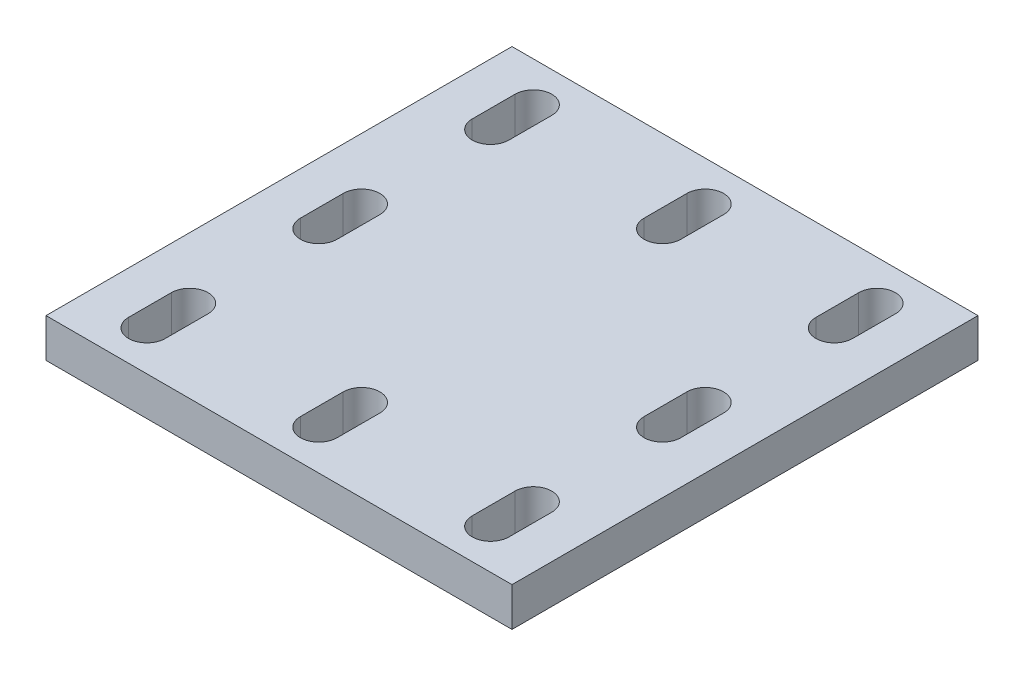
from build123d import *

# Parameters (mm, degrees)
SKETCH1_W           = 76.2
SKETCH1_H           = 76.2
BOSS_EXTRUDE1_DEPTH = 6.35
SKETCH2_R           = 3
BOSS_EXTRUDE2_DEPTH = 10
SKETCH3_R           = 1.5875
CUT_EXTRUDE1_DEPTH  = 10
CUT_EXTRUDE2_DEPTH  = 57.307570539


with BuildPart() as part:
    # Sketch1 → Boss-Extrude1 (new body)
    with BuildSketch(Plane(origin=(0, 0, 0), x_dir=(1, 0, 0), z_dir=(0, 1, 0))):
        Rectangle(SKETCH1_W, SKETCH1_H)
    extrude(amount=BOSS_EXTRUDE1_DEPTH)

    # Sketch2 → Boss-Extrude2 (add)
    with BuildSketch(Plane.XZ):
        Circle(SKETCH2_R)
    extrude(amount=BOSS_EXTRUDE2_DEPTH)

    # Sketch3 → Cut-Extrude1 (cut)
    with BuildSketch(Plane.XZ.offset(10)):
        Circle(SKETCH3_R)
    extrude(amount=-CUT_EXTRUDE1_DEPTH, mode=Mode.SUBTRACT)

    # Sketch5 → Cut-Extrude2 (cut, through all)
    with BuildSketch(Plane(origin=(0, 6.35, 0), x_dir=(1, 0, 0), z_dir=(0, 1, 0))):
        with BuildLine():
            Line((-25.1, 31.6), (-25.1, 24.6))
            ThreePointArc((-25.1, 24.6), (-28.1, 21.6), (-31.1, 24.6))
            Line((-31.1, 24.6), (-31.1, 31.6))
            ThreePointArc((-31.1, 31.6), (-28.1, 34.6), (-25.1, 31.6))
        make_face()
        with BuildLine():
            Line((-3, 31.6), (-3, 24.6))
            ThreePointArc((-3, 24.6), (0, 21.6), (3, 24.6))
            Line((3, 24.6), (3, 31.6))
            ThreePointArc((3, 31.6), (0, 34.6), (-3, 31.6))
        make_face()
        with BuildLine():
            Line((25.1, 31.6), (25.1, 24.6))
            ThreePointArc((25.1, 24.6), (28.1, 21.6), (31.1, 24.6))
            Line((31.1, 24.6), (31.1, 31.6))
            ThreePointArc((31.1, 31.6), (28.1, 34.6), (25.1, 31.6))
        make_face()
        with BuildLine():
            Line((25.1, 3.5), (25.1, -3.5))
            ThreePointArc((25.1, -3.5), (28.1, -6.5), (31.1, -3.5))
            Line((31.1, -3.5), (31.1, 3.5))
            ThreePointArc((31.1, 3.5), (28.1, 6.5), (25.1, 3.5))
        make_face()
        with BuildLine():
            Line((-3, -24.6), (-3, -31.6))
            ThreePointArc((-3, -31.6), (0, -34.6), (3, -31.6))
            Line((3, -31.6), (3, -24.6))
            ThreePointArc((3, -24.6), (0, -21.6), (-3, -24.6))
        make_face()
        with BuildLine():
            Line((25.1, -24.6), (25.1, -31.6))
            ThreePointArc((25.1, -31.6), (28.1, -34.6), (31.1, -31.6))
            Line((31.1, -31.6), (31.1, -24.6))
            ThreePointArc((31.1, -24.6), (28.1, -21.6), (25.1, -24.6))
        make_face()
        with BuildLine():
            Line((-31.1, 3.5), (-31.1, -3.5))
            ThreePointArc((-31.1, -3.5), (-28.1, -6.5), (-25.1, -3.5))
            Line((-25.1, -3.5), (-25.1, 3.5))
            ThreePointArc((-25.1, 3.5), (-28.1, 6.5), (-31.1, 3.5))
        make_face()
        with BuildLine():
            Line((-31.1, -24.6), (-31.1, -31.6))
            ThreePointArc((-31.1, -31.6), (-28.1, -34.6), (-25.1, -31.6))
            Line((-25.1, -31.6), (-25.1, -24.6))
            ThreePointArc((-25.1, -24.6), (-28.1, -21.6), (-31.1, -24.6))
        make_face()
    extrude(amount=-CUT_EXTRUDE2_DEPTH, mode=Mode.SUBTRACT)


solid = part.part
